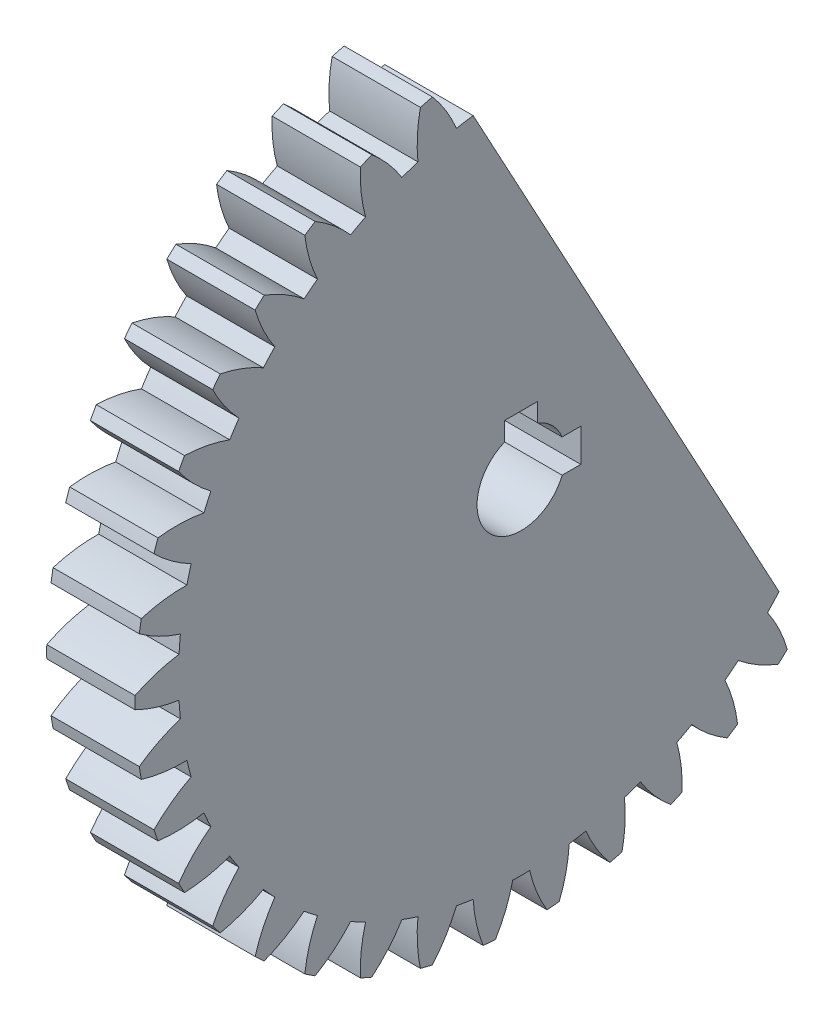
from build123d import *

# Parameters (mm, degrees)
SPUR_START          = -0.836441595
SPUR_GEAR_ISO_DEPTH = 8
CUT_EXTRUDE1_DEPTH  = 10


# Read off the part's stored shape, not the designer's step: spur gear_iso
with BuildPart() as part:
    # spur gear_iso outline → spur gear_iso (new body)
    with BuildSketch(Plane.YZ.offset(SPUR_START)):
        with BuildLine():
            ThreePointArc((0.193554315, 35.685865987), (-0.366460238, 35.690346507), (-0.926474791, 35.685865987))
            ThreePointArc((-0.926474791, 35.685865987), (-1.703131377, 33.74169122), (-2.165081056, 31.699728078))
            ThreePointArc((-2.165081056, 31.699728078), (-2.931498577, 31.645755736), (-3.696346718, 31.572843787))
            ThreePointArc((-3.696346718, 31.572843787), (-4.488092093, 33.510922795), (-5.574156744, 35.300748081))
            ThreePointArc((-5.574156744, 35.300748081), (-6.127270898, 35.212992126), (-6.678910113, 35.116397349))
            ThreePointArc((-6.678910113, 35.116397349), (-7.124973466, 33.070905119), (-7.244526667, 30.980757274))
            ThreePointArc((-7.244526667, 30.980757274), (-7.991607697, 30.801372867), (-8.734023394, 30.603565476))
            ThreePointArc((-8.734023394, 30.603565476), (-9.833967713, 32.384894607), (-11.199815418, 33.971548642))
            ThreePointArc((-11.199815418, 33.971548642), (-11.73094166, 33.793949966), (-12.259158258, 33.607875786))
            ThreePointArc((-12.259158258, 33.607875786), (-12.362460932, 31.516861788), (-12.136356555, 29.435543026))
            ThreePointArc((-12.136356555, 29.435543026), (-12.843722671, 29.135639693), (-13.543454759, 28.818332529))
            ThreePointArc((-13.543454759, 28.818332529), (-14.92159441, 30.394321768), (-16.529968403, 31.734524766))
            ThreePointArc((-16.529968403, 31.734524766), (-17.024618994, 31.471927799), (-17.515004602, 31.201449833))
            ThreePointArc((-17.515004602, 31.201449833), (-17.272728771, 29.12195148), (-16.707134354, 27.10623475))
            ThreePointArc((-16.707134354, 27.10623475), (-17.355490452, 26.693993071), (-17.993452063, 26.265841447))
            ThreePointArc((-17.993452063, 26.265841447), (-19.612194989, 27.593501916), (-21.419223021, 28.650696634))
            ThreePointArc((-21.419223021, 28.650696634), (-21.863905182, 28.310264336), (-22.30308336, 27.962760519))
            ThreePointArc((-22.30308336, 27.962760519), (-21.721837675, 25.951501104), (-20.83218116, 24.056369904))
            ThreePointArc((-20.83218116, 24.056369904), (-21.403841775, 23.543034758), (-21.962630981, 23.015717534))
            ThreePointArc((-21.962630981, 23.015717534), (-23.777822094, 24.058834116), (-25.73421315, 24.804183037))
            ThreePointArc((-25.73421315, 24.804183037), (-26.116797112, 24.395201514), (-26.492788223, 23.980150843))
            ThreePointArc((-26.492788223, 23.980150843), (-25.588427553, 22.09199228), (-24.398976449, 20.36914085))
            ThreePointArc((-24.398976449, 20.36914085), (-24.878348171, 19.768714682), (-25.342722657, 19.156615697))
            ThreePointArc((-25.342722657, 19.156615697), (-27.304848275, 19.886734891), (-29.357237108, 20.29990684))
            ThreePointArc((-29.357237108, 20.29990684), (-29.667286977, 19.833532041), (-29.969834965, 19.362256018))
            ThreePointArc((-29.969834965, 19.362256018), (-28.76702791, 17.648702351), (-27.310227344, 16.145125586))
            ThreePointArc((-27.310227344, 16.145125586), (-27.684234161, 15.473986456), (-28.041527003, 14.793802175))
            ThreePointArc((-28.041527003, 14.793802175), (-30.097065455, 15.191008232), (-32.189468247, 15.260732956))
            ThreePointArc((-32.189468247, 15.260732956), (-32.418526671, 14.74968637), (-32.639378814, 14.235040175))
            ThreePointArc((-32.639378814, 14.235040175), (-31.170934817, 12.742832681), (-29.48652251, 11.499544235))
            ThreePointArc((-29.48652251, 11.499544235), (-29.744962491, 10.775999069), (-29.985427672, 10.046283147))
            ThreePointArc((-29.985427672, 10.046283147), (-32.078309227, 10.099741322), (-34.153650684, 9.824116911))
            ThreePointArc((-34.153650684, 9.824116911), (-34.295469546, 9.282338557), (-34.428601574, 8.738360398))
            ThreePointArc((-34.428601574, 8.738360398), (-32.734575958, 7.508202607), (-30.868498287, 6.559116149))
            ThreePointArc((-30.868498287, 6.559116149), (-31.004321864, 5.802901373), (-31.121400119, 5.043558556))
            ThreePointArc((-31.121400119, 5.043558556), (-33.194536424, 4.751810649), (-35.196206642, 4.138355419))
            ThreePointArc((-35.196206642, 4.138355419), (-35.246917493, 3.580623598), (-35.288697912, 3.022151781))
            ThreePointArc((-35.288697912, 3.022151781), (-33.41529928, 2.087599191), (-31.418457979, 1.458603325))
            ThreePointArc((-31.418457979, 1.458603325), (-31.427960238, 0.690346507), (-31.418457979, -0.077910311))
            ThreePointArc((-31.418457979, -0.077910311), (-33.41529928, -0.706906177), (-35.288697912, -1.641458767))
            ThreePointArc((-35.288697912, -1.641458767), (-35.246917493, -2.199930585), (-35.196206642, -2.757662406))
            ThreePointArc((-35.196206642, -2.757662406), (-33.194536424, -3.371117636), (-31.121400119, -3.662865543))
            ThreePointArc((-31.121400119, -3.662865543), (-31.004321864, -4.422208359), (-30.868498287, -5.178423135))
            ThreePointArc((-30.868498287, -5.178423135), (-32.734575958, -6.127509593), (-34.428601574, -7.357667384))
            ThreePointArc((-34.428601574, -7.357667384), (-34.295469546, -7.901645543), (-34.153650684, -8.443423897))
            ThreePointArc((-34.153650684, -8.443423897), (-32.078309227, -8.719048308), (-29.985427672, -8.665590133))
            ThreePointArc((-29.985427672, -8.665590133), (-29.744962491, -9.395306056), (-29.48652251, -10.118851222))
            ThreePointArc((-29.48652251, -10.118851222), (-31.170934817, -11.362139667), (-32.639378814, -12.854347162))
            ThreePointArc((-32.639378814, -12.854347162), (-32.418526671, -13.368993356), (-32.189468247, -13.880039942))
            ThreePointArc((-32.189468247, -13.880039942), (-30.097065455, -13.810315218), (-28.041527003, -13.413109161))
            ThreePointArc((-28.041527003, -13.413109161), (-27.684234161, -14.093293442), (-27.310227344, -14.764432572))
            ThreePointArc((-27.310227344, -14.764432572), (-28.76702791, -16.268009337), (-29.969834965, -17.981563004))
            ThreePointArc((-29.969834965, -17.981563004), (-29.667286977, -18.452839027), (-29.357237108, -18.919213826))
            ThreePointArc((-29.357237108, -18.919213826), (-27.304848276, -18.506041877), (-25.342722657, -17.775922684))
            ThreePointArc((-25.342722657, -17.775922684), (-24.87834817, -18.388021669), (-24.398976449, -18.988447837))
            ThreePointArc((-24.398976449, -18.988447837), (-25.588427553, -20.711299267), (-26.492788223, -22.59945783))
            ThreePointArc((-26.492788223, -22.59945783), (-26.116797112, -23.0145085), (-25.73421315, -23.423490024))
            ThreePointArc((-25.73421315, -23.423490024), (-23.777822094, -22.678141102), (-21.962630981, -21.635024521))
            ThreePointArc((-21.962630981, -21.635024521), (-21.403841775, -22.162341744), (-20.83218116, -22.67567689))
            ThreePointArc((-20.83218116, -22.67567689), (-21.721837675, -24.57080809), (-22.30308336, -26.582067505))
            ThreePointArc((-22.30308336, -26.582067505), (-21.863905182, -26.929571322), (-21.419223021, -27.27000362))
            ThreePointArc((-21.419223021, -27.27000362), (-19.612194989, -26.212808902), (-17.993452063, -24.885148434))
            ThreePointArc((-17.993452063, -24.885148434), (-17.355490452, -25.313300058), (-16.707134354, -25.725541736))
            ThreePointArc((-16.707134354, -25.725541736), (-17.272728771, -27.741258466), (-17.515004602, -29.820756819))
            ThreePointArc((-17.515004602, -29.820756819), (-17.024618994, -30.091234785), (-16.529968403, -30.353831752))
            ThreePointArc((-16.529968403, -30.353831752), (-14.92159441, -29.013628754), (-13.543454759, -27.437639515))
            ThreePointArc((-13.543454759, -27.437639515), (-12.843722671, -27.754946679), (-12.136356555, -28.054850012))
            ThreePointArc((-12.136356555, -28.054850012), (-12.362460932, -30.136168774), (-12.259158258, -32.227182772))
            ThreePointArc((-12.259158258, -32.227182772), (-11.73094166, -32.413256953), (-11.199815418, -32.590855628))
            ThreePointArc((-11.199815418, -32.590855628), (-9.833967713, -31.004201593), (-8.734023394, -29.222872462))
            ThreePointArc((-8.734023394, -29.222872462), (-7.991607697, -29.420679854), (-7.244526667, -29.60006426))
            ThreePointArc((-7.244526667, -29.60006426), (-7.124973466, -31.690212105), (-6.678910113, -33.735704335))
            ThreePointArc((-6.678910113, -33.735704335), (-6.127270898, -33.832299112), (-5.574156744, -33.920055067))
            ThreePointArc((-5.574156744, -33.920055067), (-4.488092093, -32.130229782), (-3.696346718, -30.192150774))
            ThreePointArc((-3.696346718, -30.192150774), (-2.931498577, -30.265062723), (-2.165081056, -30.319035064))
            ThreePointArc((-2.165081056, -30.319035064), (-1.703131377, -32.360998206), (-0.926474791, -34.305172973))
            ThreePointArc((-0.926474791, -34.305172973), (-0.366460238, -34.309653493), (0.193554315, -34.305172973))
            ThreePointArc((0.193554315, -34.305172973), (0.970210901, -32.360998206), (1.43216058, -30.319035064))
            ThreePointArc((1.43216058, -30.319035064), (2.198578101, -30.265062723), (2.963426242, -30.192150774))
            ThreePointArc((2.963426242, -30.192150774), (3.755171617, -32.130229782), (4.841236268, -33.920055067))
            ThreePointArc((4.841236268, -33.920055067), (5.394350422, -33.832299112), (5.945989637, -33.735704335))
            ThreePointArc((5.945989637, -33.735704335), (6.39205299, -31.690212105), (6.511606191, -29.60006426))
            ThreePointArc((6.511606191, -29.60006426), (7.258687221, -29.420679854), (8.001102917, -29.222872462))
            ThreePointArc((8.001102917, -29.222872462), (9.101047237, -31.004201593), (10.466894942, -32.590855628))
            ThreePointArc((10.466894942, -32.590855628), (10.998021184, -32.413256953), (11.526237782, -32.227182772))
            ThreePointArc((11.526237782, -32.227182772), (11.629540456, -30.136168774), (11.403436079, -28.054850012))
            ThreePointArc((11.403436079, -28.054850012), (12.110802195, -27.754946679), (12.810534283, -27.437639515))
            ThreePointArc((12.810534283, -27.437639515), (14.188673934, -29.013628754), (15.797047927, -30.353831752))
            ThreePointArc((15.797047927, -30.353831752), (16.291698518, -30.091234785), (16.782084126, -29.820756819))
            ThreePointArc((16.782084126, -29.820756819), (16.539808295, -27.741258466), (15.974213878, -25.725541736))
            ThreePointArc((15.974213878, -25.725541736), (16.622569976, -25.313300058), (17.260531587, -24.885148434))
            ThreePointArc((17.260531587, -24.885148434), (18.879274513, -26.212808902), (20.686302544, -27.27000362))
            ThreePointArc((20.686302544, -27.27000362), (21.130984706, -26.929571322), (21.570162884, -26.582067505))
            ThreePointArc((21.570162884, -26.582067505), (20.988917199, -24.57080809), (20.099260684, -22.67567689))
            ThreePointArc((20.099260684, -22.67567689), (20.670921299, -22.162341744), (21.229710504, -21.635024521))
            ThreePointArc((21.229710504, -21.635024521), (23.044901618, -22.678141102), (25.001292674, -23.423490024))
            ThreePointArc((25.001292674, -23.423490024), (25.383876635, -23.0145085), (25.759867747, -22.59945783))
            ThreePointArc((25.759867747, -22.59945783), (24.855507077, -20.711299267), (23.666055973, -18.988447837))
            ThreePointArc((23.666055973, -18.988447837), (24.145427694, -18.388021669), (24.609802181, -17.775922684))
            ThreePointArc((24.609802181, -17.775922684), (26.5719278, -18.506041877), (28.624316632, -18.919213826))
            ThreePointArc((28.624316632, -18.919213826), (28.934366501, -18.452839027), (29.236914489, -17.981563004))
            ThreePointArc((29.236914489, -17.981563004), (28.034107434, -16.268009337), (26.577306868, -14.764432572))
            ThreePointArc((26.577306868, -14.764432572), (26.951313685, -14.093293442), (27.308606527, -13.413109161))
            ThreePointArc((27.308606527, -13.413109161), (29.364144979, -13.810315218), (31.456547771, -13.880039942))
            ThreePointArc((31.456547771, -13.880039942), (31.685606195, -13.368993356), (31.906458338, -12.854347162))
            ThreePointArc((31.906458338, -12.854347162), (30.438014341, -11.362139667), (28.753602034, -10.118851222))
            ThreePointArc((28.753602034, -10.118851222), (29.012042015, -9.395306056), (29.252507196, -8.665590133))
            ThreePointArc((29.252507196, -8.665590133), (31.345388751, -8.719048308), (33.420730208, -8.443423897))
            ThreePointArc((33.420730208, -8.443423897), (33.56254907, -7.901645543), (33.695681098, -7.357667384))
            ThreePointArc((33.695681098, -7.357667384), (32.001655482, -6.127509593), (30.135577811, -5.178423135))
            ThreePointArc((30.135577811, -5.178423135), (30.271401388, -4.422208359), (30.388479643, -3.662865543))
            ThreePointArc((30.388479643, -3.662865543), (32.461615948, -3.371117636), (34.463286166, -2.757662406))
            ThreePointArc((34.463286166, -2.757662406), (34.513997017, -2.199930585), (34.555777436, -1.641458767))
            ThreePointArc((34.555777436, -1.641458767), (32.682378804, -0.706906177), (30.685537503, -0.077910311))
            ThreePointArc((30.685537503, -0.077910311), (30.695039762, 0.690346507), (30.685537503, 1.458603325))
            ThreePointArc((30.685537503, 1.458603325), (32.682378804, 2.087599191), (34.555777436, 3.022151781))
            ThreePointArc((34.555777436, 3.022151781), (34.513997017, 3.580623598), (34.463286166, 4.138355419))
            ThreePointArc((34.463286166, 4.138355419), (32.461615948, 4.751810649), (30.388479643, 5.043558556))
            ThreePointArc((30.388479643, 5.043558556), (30.271401388, 5.802901373), (30.135577811, 6.559116149))
            ThreePointArc((30.135577811, 6.559116149), (32.001655482, 7.508202607), (33.695681098, 8.738360398))
            ThreePointArc((33.695681098, 8.738360398), (33.56254907, 9.282338557), (33.420730208, 9.824116911))
            ThreePointArc((33.420730208, 9.824116911), (31.345388751, 10.099741322), (29.252507196, 10.046283147))
            ThreePointArc((29.252507196, 10.046283147), (29.012042015, 10.775999069), (28.753602034, 11.499544235))
            ThreePointArc((28.753602034, 11.499544235), (30.438014341, 12.742832681), (31.906458338, 14.235040175))
            ThreePointArc((31.906458338, 14.235040175), (31.685606195, 14.74968637), (31.456547771, 15.260732956))
            ThreePointArc((31.456547771, 15.260732956), (29.364144979, 15.191008232), (27.308606527, 14.793802175))
            ThreePointArc((27.308606527, 14.793802175), (26.951313685, 15.473986456), (26.577306868, 16.145125586))
            ThreePointArc((26.577306868, 16.145125586), (28.034107434, 17.648702351), (29.236914489, 19.362256018))
            ThreePointArc((29.236914489, 19.362256018), (28.934366501, 19.833532041), (28.624316632, 20.29990684))
            ThreePointArc((28.624316632, 20.29990684), (26.571927799, 19.886734891), (24.609802181, 19.156615697))
            ThreePointArc((24.609802181, 19.156615697), (24.145427695, 19.768714682), (23.666055973, 20.36914085))
            ThreePointArc((23.666055973, 20.36914085), (24.855507077, 22.09199228), (25.759867747, 23.980150843))
            ThreePointArc((25.759867747, 23.980150843), (25.383876636, 24.395201513), (25.001292674, 24.804183037))
            ThreePointArc((25.001292674, 24.804183037), (23.044901617, 24.058834116), (21.229710504, 23.015717534))
            ThreePointArc((21.229710504, 23.015717534), (20.670921299, 23.543034758), (20.099260684, 24.056369904))
            ThreePointArc((20.099260684, 24.056369904), (20.988917199, 25.951501104), (21.570162884, 27.962760519))
            ThreePointArc((21.570162884, 27.962760519), (21.130984706, 28.310264336), (20.686302544, 28.650696634))
            ThreePointArc((20.686302544, 28.650696634), (18.879274513, 27.593501916), (17.260531587, 26.265841447))
            ThreePointArc((17.260531587, 26.265841447), (16.622569975, 26.693993071), (15.974213878, 27.10623475))
            ThreePointArc((15.974213878, 27.10623475), (16.539808295, 29.12195148), (16.782084126, 31.201449833))
            ThreePointArc((16.782084126, 31.201449833), (16.291698518, 31.471927799), (15.797047927, 31.734524766))
            ThreePointArc((15.797047927, 31.734524766), (14.188673934, 30.394321768), (12.810534283, 28.818332529))
            ThreePointArc((12.810534283, 28.818332529), (12.110802195, 29.135639693), (11.403436079, 29.435543026))
            ThreePointArc((11.403436079, 29.435543026), (11.629540456, 31.516861788), (11.526237782, 33.607875786))
            ThreePointArc((11.526237782, 33.607875786), (10.998021184, 33.793949966), (10.466894942, 33.971548642))
            ThreePointArc((10.466894942, 33.971548642), (9.101047237, 32.384894607), (8.001102917, 30.603565476))
            ThreePointArc((8.001102917, 30.603565476), (7.258687221, 30.801372867), (6.511606191, 30.980757274))
            ThreePointArc((6.511606191, 30.980757274), (6.39205299, 33.070905119), (5.945989637, 35.116397349))
            ThreePointArc((5.945989637, 35.116397349), (5.394350422, 35.212992126), (4.841236268, 35.300748081))
            ThreePointArc((4.841236268, 35.300748081), (3.755171617, 33.510922795), (2.963426242, 31.572843787))
            ThreePointArc((2.963426242, 31.572843787), (2.198578101, 31.645755736), (1.43216058, 31.699728078))
            ThreePointArc((1.43216058, 31.699728078), (0.970210901, 33.74169122), (0.193554315, 35.685865987))
        make_face()
        with BuildLine():
            Line((-1.866460238, -4.709653493), (-1.866460238, -3.017752737))
            ThreePointArc((-1.866460238, -3.017752737), (-3.194887364, 3.518773631), (3.341639005, 2.190346507))
            Line((3.341639005, 2.190346507), (5.033539762, 2.190346507))
            Line((5.033539762, 2.190346507), (5.033539762, -0.809653493))
            Line((5.033539762, -0.809653493), (3.341639005, -0.809653493))
            ThreePointArc((3.341639005, -0.809653493), (2.461966887, -2.138080618), (1.133539762, -3.017752737))
            Line((1.133539762, -3.017752737), (1.133539762, -4.709653493))
            Line((1.133539762, -4.709653493), (-1.866460238, -4.709653493))
        make_face(mode=Mode.SUBTRACT)
    extrude(amount=SPUR_GEAR_ISO_DEPTH)

    # Sketch2 → Cut-Extrude1 (cut)
    with BuildSketch(Plane(origin=(7.163558405, 0, 0), x_dir=(0, 0, -1), z_dir=(1, 0, 0))):
        Polygon((22.67567689, -20.83218116), (-5.043558556, 30.388479643), (-6.367531584, 32.20689244), (-0.770873955, 42.111768532), (41.868409711, 13.605051974), (28.984018046, -24.766276954), align=None)
    extrude(amount=-CUT_EXTRUDE1_DEPTH, mode=Mode.SUBTRACT)


solid = part.part
